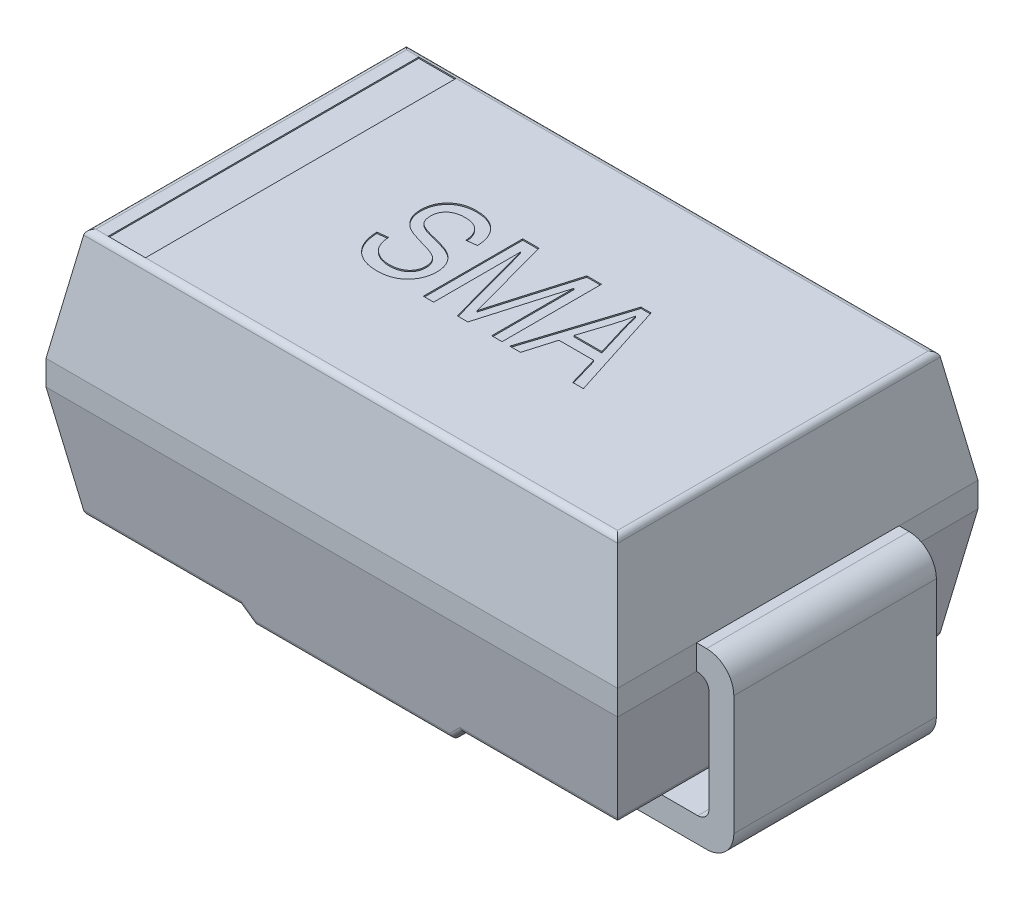
from build123d import *
from OCP.BRepFilletAPI import BRepFilletAPI_MakeChamfer

# Parameters (mm, degrees)
EXTRUDE_1_DEPTH     = 1.45
EXTRUDE_2_DEPTH     = 0.815
CHAMFER_1_SIZE      = 0.9
CHAMFER_1_SIZE_2    = 0.158694283
CHAMFER_2_SIZE      = 1
CHAMFER_2_SIZE2     = 0.176326981
FILLET_1_R          = 0.05
SKETCH_3_W          = 0.3
SKETCH_3_H          = 2.498701472
CUT_EXTRUDE_1_DEPTH = 0.01


with BuildPart() as part:
    # Эскиз1 → Бобышка-Вытянуть1 (new, symmetric)
    with BuildSketch(Plane.XY):
        Polygon((-2.3, 2.1), (-2.3, 0.1), (-0.9, 0.1), (-0.8, 0), (0.8, 0), (0.9, 0.1), (2.3, 0.1), (2.3, 2.1), align=None)
    extrude(amount=EXTRUDE_1_DEPTH, both=True)


with BuildPart() as body_2:
    # Эскиз2 → Бобышка-Вытянуть2 (new, symmetric)
    with BuildSketch(Plane.XY):
        with BuildLine():
            Line((2.3, 1.2), (2.380710678, 1.2))
            ThreePointArc((2.380710678, 1.2), (2.535771645, 1.135771645), (2.6, 0.980710678))
            Line((2.6, 0.980710678), (2.6, 0.019289322))
            ThreePointArc((2.6, 0.019289322), (2.535771645, -0.135771645), (2.380710678, -0.2))
            Line((2.380710678, -0.2), (1.1, -0.2))
            Line((1.1, -0.2), (1.1, 0))
            Line((1.1, 0), (2.31, 0))
            ThreePointArc((2.31, 0), (2.37363961, 0.02636039), (2.4, 0.09))
            Line((2.4, 0.09), (2.4, 0.91))
            ThreePointArc((2.4, 0.91), (2.37363961, 0.97363961), (2.31, 1))
            Line((2.31, 1), (2.3, 1))
            Line((2.3, 1), (2.3, 1.2))
        make_face()
    extrude_2 = extrude(amount=EXTRUDE_2_DEPTH, both=True)


with BuildPart() as part_1:
    add(part.part)

    # Зеркальное отражение2: Бобышка-Вытянуть2 across plane
    add(extrude_2.mirror(Plane(origin=(0, 0, 0), x_dir=(0, 0, 1), z_dir=(1, 0, 0))))

    # Фаска1
    # the kernel refuses this chamfer: 0.9, 0.158694283 mm, written as the material it takes off along each edge
    with BuildSketch(Plane(origin=(4.638684917, 2.1, -1.45), x_dir=(0, -0.9999776716360547, -0.006682531656101768), z_dir=(-1, 0, 0))) as chamfer_1_piece_1:
        Polygon((CHAMFER_1_SIZE * 0.999977671636, CHAMFER_1_SIZE * 0.0066825316561), (-CHAMFER_1_SIZE_2 * 0.00668253164084, CHAMFER_1_SIZE_2 * 0.999977669353), (0, 0), align=None)
    extrude(amount=9.277369834, mode=Mode.SUBTRACT)
    with BuildSketch(Plane(origin=(2.3, 2.1, 3.788684917), x_dir=(-0.9776715712462589, 0.21013876076743046, 0), z_dir=(0, 0, -1))) as chamfer_1_piece_2:
        Polygon((CHAMFER_1_SIZE_2 * 0.977671569014, -CHAMFER_1_SIZE_2 * 0.210138760288), (-CHAMFER_1_SIZE * 0.210138760767, -CHAMFER_1_SIZE * 0.977671571246), (0, 0), align=None)
    extrude(amount=7.577369834, mode=Mode.SUBTRACT)
    with BuildSketch(Plane(origin=(2.3, 0.1, 3.788684917), x_dir=(-0.9776715712462586, -0.21013876076743146, 0), z_dir=(0, 0, -1))) as chamfer_1_piece_3:
        Polygon((CHAMFER_1_SIZE_2 * 0.977671569014, CHAMFER_1_SIZE_2 * 0.210138760288), (-CHAMFER_1_SIZE * 0.210138760767, CHAMFER_1_SIZE * 0.977671571246), (0, 0), align=None)
    extrude(amount=7.577369834, mode=Mode.SUBTRACT)
    with BuildSketch(Plane(origin=(-2.3, 0.1, -3.788684917), x_dir=(-0.006682531656101531, 0.9999776716360547, 0), z_dir=(0, 0, 1))) as chamfer_1_piece_4_section:
        Polygon((CHAMFER_1_SIZE * 0.999977671636, -CHAMFER_1_SIZE * 0.0066825316561), (-CHAMFER_1_SIZE_2 * 0.00668253164084, -CHAMFER_1_SIZE_2 * 0.999977669353), (0, 0), align=None)
    chamfer_1_piece_4 = extrude(amount=7.577369834, mode=Mode.PRIVATE)
    chamfer_1_piece_4 = split(chamfer_1_piece_4, bisect_by=Plane(origin=(-2.256706668, 0.418093055, -0.815), z_dir=(0, 0, -1)), keep=Keep.TOP, mode=Mode.PRIVATE)
    chamfer_1_piece_4 = split(chamfer_1_piece_4, bisect_by=Plane(origin=(-2.256706668, 1, -2.301842458), z_dir=(0, -1, 0)), keep=Keep.TOP, mode=Mode.PRIVATE)
    add(chamfer_1_piece_4, mode=Mode.SUBTRACT)
    with BuildSketch(Plane(origin=(-2.3, 0.1, -3.788684917), x_dir=(-0.006682531656101531, 0.9999776716360547, 0), z_dir=(0, 0, 1))) as chamfer_1_piece_5_section:
        Polygon((CHAMFER_1_SIZE * 0.999977671636, -CHAMFER_1_SIZE * 0.0066825316561), (-CHAMFER_1_SIZE_2 * 0.00668253164084, -CHAMFER_1_SIZE_2 * 0.999977669353), (0, 0), align=None)
    chamfer_1_piece_5 = extrude(amount=7.577369834, mode=Mode.PRIVATE)
    chamfer_1_piece_5 = split(chamfer_1_piece_5, bisect_by=Plane(origin=(-2.256706668, 0.418093055, 0.815), z_dir=(0, 0, -1)), keep=Keep.TOP, mode=Mode.PRIVATE)
    chamfer_1_piece_5 = split(chamfer_1_piece_5, bisect_by=Plane(origin=(-2.256706668, 0.418093055, -0.815), z_dir=(0, 0, 1)), keep=Keep.TOP, mode=Mode.PRIVATE)
    chamfer_1_piece_5 = split(chamfer_1_piece_5, bisect_by=Plane(origin=(-2.256706668, 1, 0), z_dir=(0, -1, 0)), keep=Keep.TOP, mode=Mode.PRIVATE)
    add(chamfer_1_piece_5, mode=Mode.SUBTRACT)
    with BuildSketch(Plane(origin=(-2.3, 0.1, -3.788684917), x_dir=(-0.006682531656101531, 0.9999776716360547, 0), z_dir=(0, 0, 1))) as chamfer_1_piece_6_section:
        Polygon((CHAMFER_1_SIZE * 0.999977671636, -CHAMFER_1_SIZE * 0.0066825316561), (-CHAMFER_1_SIZE_2 * 0.00668253164084, -CHAMFER_1_SIZE_2 * 0.999977669353), (0, 0), align=None)
    chamfer_1_piece_6 = extrude(amount=7.577369834, mode=Mode.PRIVATE)
    chamfer_1_piece_6 = split(chamfer_1_piece_6, bisect_by=Plane(origin=(-2.256706668, 0.418093055, 0.815), z_dir=(0, 0, 1)), keep=Keep.TOP, mode=Mode.PRIVATE)
    chamfer_1_piece_6 = split(chamfer_1_piece_6, bisect_by=Plane(origin=(-2.256706668, 1, 2.301842458), z_dir=(0, -1, 0)), keep=Keep.TOP, mode=Mode.PRIVATE)
    add(chamfer_1_piece_6, mode=Mode.SUBTRACT)
    with BuildSketch(Plane(origin=(-2.3, 2.1, 3.788684917), x_dir=(-0.006682531656101531, -0.9999776716360547, 0), z_dir=(0, 0, -1))) as chamfer_1_piece_7_section:
        Polygon((CHAMFER_1_SIZE * 0.999977671636, -CHAMFER_1_SIZE * 0.0066825316561), (-CHAMFER_1_SIZE_2 * 0.00668253164084, -CHAMFER_1_SIZE_2 * 0.999977669353), (0, 0), align=None)
    chamfer_1_piece_7 = extrude(amount=7.577369834, mode=Mode.PRIVATE)
    chamfer_1_piece_7 = split(chamfer_1_piece_7, bisect_by=Plane(origin=(-2.256706668, 1.781906945, 0.815), z_dir=(0, 0, 1)), keep=Keep.TOP, mode=Mode.PRIVATE)
    chamfer_1_piece_7 = split(chamfer_1_piece_7, bisect_by=Plane(origin=(-2.256706668, 1.2, 2.301842458), z_dir=(0, 1, 0)), keep=Keep.TOP, mode=Mode.PRIVATE)
    add(chamfer_1_piece_7, mode=Mode.SUBTRACT)
    with BuildSketch(Plane(origin=(-2.3, 2.1, 3.788684917), x_dir=(-0.006682531656101531, -0.9999776716360547, 0), z_dir=(0, 0, -1))) as chamfer_1_piece_8_section:
        Polygon((CHAMFER_1_SIZE * 0.999977671636, -CHAMFER_1_SIZE * 0.0066825316561), (-CHAMFER_1_SIZE_2 * 0.00668253164084, -CHAMFER_1_SIZE_2 * 0.999977669353), (0, 0), align=None)
    chamfer_1_piece_8 = extrude(amount=7.577369834, mode=Mode.PRIVATE)
    chamfer_1_piece_8 = split(chamfer_1_piece_8, bisect_by=Plane(origin=(-2.256706668, 1.781906945, 0.815), z_dir=(0, 0, -1)), keep=Keep.TOP, mode=Mode.PRIVATE)
    chamfer_1_piece_8 = split(chamfer_1_piece_8, bisect_by=Plane(origin=(-2.256706668, 1.2, 0), z_dir=(0, 1, 0)), keep=Keep.TOP, mode=Mode.PRIVATE)
    chamfer_1_piece_8 = split(chamfer_1_piece_8, bisect_by=Plane(origin=(-2.256706668, 1.781906945, -0.815), z_dir=(0, 0, 1)), keep=Keep.TOP, mode=Mode.PRIVATE)
    add(chamfer_1_piece_8, mode=Mode.SUBTRACT)
    with BuildSketch(Plane(origin=(-2.3, 2.1, 3.788684917), x_dir=(-0.006682531656101531, -0.9999776716360547, 0), z_dir=(0, 0, -1))) as chamfer_1_piece_9_section:
        Polygon((CHAMFER_1_SIZE * 0.999977671636, -CHAMFER_1_SIZE * 0.0066825316561), (-CHAMFER_1_SIZE_2 * 0.00668253164084, -CHAMFER_1_SIZE_2 * 0.999977669353), (0, 0), align=None)
    chamfer_1_piece_9 = extrude(amount=7.577369834, mode=Mode.PRIVATE)
    chamfer_1_piece_9 = split(chamfer_1_piece_9, bisect_by=Plane(origin=(-2.256706668, 1.2, -2.301842458), z_dir=(0, 1, 0)), keep=Keep.TOP, mode=Mode.PRIVATE)
    chamfer_1_piece_9 = split(chamfer_1_piece_9, bisect_by=Plane(origin=(-2.256706668, 1.781906945, -0.815), z_dir=(0, 0, -1)), keep=Keep.TOP, mode=Mode.PRIVATE)
    add(chamfer_1_piece_9, mode=Mode.SUBTRACT)
    with BuildSketch(Plane(origin=(4.638684917, 2.1, 1.45), x_dir=(0, 0.21013876076743018, -0.9776715712462589), z_dir=(-1, 0, 0))) as chamfer_1_piece_10:
        Polygon((CHAMFER_1_SIZE_2 * 0.977671569014, CHAMFER_1_SIZE_2 * 0.210138760288), (-CHAMFER_1_SIZE * 0.210138760767, CHAMFER_1_SIZE * 0.977671571246), (0, 0), align=None)
    extrude(amount=9.277369834, mode=Mode.SUBTRACT)

    # Фаска2: one chamfer whose edges measure the first distance from different faces: ONE call of the kernel's chamfer builder (chamfer() names one face for all edges)
    chamfer_2_edges_1 = [part_1.edges().sort_by_distance(p)[0] for p in [
        (0, 0, -1.45),
    ]]
    chamfer_2_side_1 = [part_1.faces().sort_by_distance(p)[0] for p in [
        (0, 0.63700121, -1.45),
    ]]
    chamfer_2_edges_2 = [part_1.edges().sort_by_distance(p)[0] for p in [
        (0, 0, 1.45),
    ]]
    chamfer_2_side_2 = [part_1.faces().sort_by_distance(p)[0] for p in [
        (0, 0.63700121, 1.45),
    ]]
    chamfer_2 = BRepFilletAPI_MakeChamfer(part_1.part.solid().wrapped)
    for e in chamfer_2_edges_1:
        chamfer_2.Add(CHAMFER_2_SIZE, CHAMFER_2_SIZE2, e.wrapped, chamfer_2_side_1[0].wrapped)  # the first distance lies on this face
    for e in chamfer_2_edges_2:
        chamfer_2.Add(CHAMFER_2_SIZE, CHAMFER_2_SIZE2, e.wrapped, chamfer_2_side_2[0].wrapped)  # the first distance lies on this face
    add(Compound.cast(chamfer_2.Shape()), mode=Mode.REPLACE)

    # Скругление1
    fillet_1_edges = [part_1.edges().sort_by_distance(p)[0] for p in [
        (2.141305717, 2.1, 0),
        (0, 2.1, 1.291305717),
        (-2.141305717, 2.1, 0),
        (0, 2.1, -1.291305717),
        (0, 0, 1.273673019),
        (0, 0, -1.273673019),
        (0.85, 0.05, 1.282489368),
        (0.85, 0.05, -1.282489368),
        (2.141305717, 0.1, 0),
        (1.520652859, 0.1, 1.291305717),
        (1.520652859, 0.1, -1.291305717),
        (-2.141305717, 0.1, 0),
        (-1.520652859, 0.1, 1.291305717),
        (-1.520652859, 0.1, -1.291305717),
        (-0.85, 0.05, 1.282489368),
        (-0.85, 0.05, -1.282489368),
    ]]
    fillet(fillet_1_edges, radius=FILLET_1_R)

    # Эскиз3 → Вырез-Вытянуть1 (cut)
    # profile 1 of 4: a face of its own
    with BuildSketch(Plane(origin=(0, 2.1, 0), x_dir=(1, 0, 0), z_dir=(0, 1, 0))):
        with Locations((-1.85, 0)):
            Rectangle(SKETCH_3_W, SKETCH_3_H)
    # profile 2 of 4: a face of its own
    with BuildSketch(Plane(origin=(0, 2.1, 0), x_dir=(1, 0, 0), z_dir=(0, 1, 0))):
        with BuildLine():
            Line((-0.948051948, -0.139610476), (-0.864935065, -0.129220866))
            add(Edge.make_bspline(
                [(-0.864935065, -0.129220866), (-0.863724835, -0.139802317), (-0.861429624, -0.159870121), (-0.855143425, -0.18797335), (-0.846735616, -0.21238928), (-0.836348316, -0.233609789), (-0.823037108, -0.251597597), (-0.807832278, -0.267774625), (-0.789923169, -0.281887699), (-0.769875629, -0.294208498), (-0.747810078, -0.304152386), (-0.7241363, -0.311023331), (-0.699188477, -0.315420952), (-0.682107704, -0.315958882), (-0.673376623, -0.316233853)],
                knots=[0, 0, 0, 0, 1.28056062, 2.428593037, 3.455857635, 4.381585452, 5.257863862, 6.137303782, 7.045121912, 7.991827123, 8.962072888, 9.946560163, 10.950355038, 12, 12, 12, 12], degree=3))
            add(Edge.make_bspline(
                [(-0.673376623, -0.316233853), (-0.667148535, -0.316107287), (-0.655044754, -0.315861317), (-0.637420248, -0.31401127), (-0.620819779, -0.311224391), (-0.605399455, -0.306888821), (-0.590872608, -0.301818823), (-0.577648189, -0.295059531), (-0.56527297, -0.287420554), (-0.554106362, -0.278526756), (-0.544259864, -0.268530418), (-0.535334695, -0.258039284), (-0.528077855, -0.246554074), (-0.521958674, -0.234527639), (-0.517471246, -0.221663909), (-0.513990672, -0.208219035), (-0.512050262, -0.19394178), (-0.511810853, -0.184204748), (-0.511688312, -0.179220866)],
                knots=[0, 0, 0, 0, 1.25000475, 2.42928239, 3.554432982, 4.624373226, 5.641561959, 6.637472043, 7.59895824, 8.557494333, 9.494616268, 10.412591127, 11.316575992, 12.215324116, 13.115580924, 14.045624415, 14.999656403, 16, 16, 16, 16], degree=3))
            add(Edge.make_bspline(
                [(-0.511688312, -0.179220866), (-0.511866993, -0.173472711), (-0.512215021, -0.162276701), (-0.515177313, -0.145978279), (-0.520228167, -0.130874404), (-0.527104191, -0.116849453), (-0.53598473, -0.104016056), (-0.546951914, -0.09243701), (-0.559983802, -0.082201721), (-0.572418727, -0.074439442), (-0.584431068, -0.068785711), (-0.595780081, -0.063912266), (-0.609447902, -0.058771589), (-0.625412385, -0.053238594), (-0.643678587, -0.047474405), (-0.664256572, -0.041298267), (-0.687074413, -0.03462921), (-0.703131678, -0.030224714), (-0.711525974, -0.027922164)],
                knots=[0, 0, 0, 0, 1.005239862, 1.957963033, 2.886140254, 3.783827184, 4.682063204, 5.60636897, 6.563082868, 7.574767638, 8.163399764, 8.884479363, 9.735568196, 10.717712603, 11.840607427, 13.08667948, 14.476996158, 16, 16, 16, 16], degree=3))
            add(Edge.make_bspline(
                [(-0.711525974, -0.027922164), (-0.719059289, -0.025796638), (-0.733577148, -0.021700422), (-0.754396147, -0.015144882), (-0.773573393, -0.008781533), (-0.790990678, -0.001992543), (-0.806866746, 0.004455018), (-0.82088905, 0.011374218), (-0.833272332, 0.018149251), (-0.847513674, 0.02713717), (-0.863068676, 0.039707622), (-0.879554822, 0.056504696), (-0.893956535, 0.07510408), (-0.905972183, 0.09550415), (-0.915717434, 0.117454418), (-0.922170441, 0.141115219), (-0.926671167, 0.166008744), (-0.927069686, 0.183149821), (-0.927272727, 0.19188303)],
                knots=[0, 0, 0, 0, 1.113815205, 2.146493548, 3.105946624, 3.988323839, 4.806360381, 5.543364066, 6.212027532, 6.814445107, 7.937696897, 9.048553401, 10.157540001, 11.276136463, 12.410655589, 13.563606105, 14.758681343, 16, 16, 16, 16], degree=3))
            add(Edge.make_bspline(
                [(-0.927272727, 0.19188303), (-0.927093563, 0.199739168), (-0.926741361, 0.215182751), (-0.923734688, 0.237786425), (-0.918968896, 0.259368366), (-0.911857389, 0.279698064), (-0.903156784, 0.299065056), (-0.892138327, 0.317080615), (-0.879397306, 0.33417647), (-0.864646139, 0.349946278), (-0.848398921, 0.364408844), (-0.830469789, 0.376839491), (-0.811237219, 0.387373234), (-0.79069719, 0.396273297), (-0.768660865, 0.40285438), (-0.745337715, 0.40748677), (-0.720696597, 0.410530864), (-0.70379725, 0.410866654), (-0.69512987, 0.411038875)],
                knots=[0, 0, 0, 0, 1.048547399, 2.061232895, 3.039277619, 3.994368589, 4.931972946, 5.868741773, 6.808014961, 7.774272834, 8.746911737, 9.706990873, 10.680354074, 11.670809819, 12.690200298, 13.744432806, 14.843158913, 16, 16, 16, 16], degree=3))
            add(Edge.make_bspline(
                [(-0.69512987, 0.411038875), (-0.683313351, 0.410708985), (-0.660256217, 0.410065284), (-0.626810306, 0.404681757), (-0.595663448, 0.395561396), (-0.566934049, 0.382870252), (-0.540846416, 0.366848558), (-0.517847998, 0.347399149), (-0.497783996, 0.324957008), (-0.481092665, 0.299280668), (-0.467583322, 0.27095718), (-0.45769102, 0.240111881), (-0.451241843, 0.206910388), (-0.449992744, 0.183904115), (-0.449350649, 0.172077836)],
                knots=[0, 0, 0, 0, 1.10297814, 2.152200164, 3.153123011, 4.125894755, 5.076644034, 6.001845166, 6.928824672, 7.877651763, 8.851800581, 9.850539915, 10.895078977, 12, 12, 12, 12], degree=3))
            Line((-0.449350649, 0.172077836), (-0.532467532, 0.161688225))
            add(Edge.make_bspline(
                [(-0.532467532, 0.161688225), (-0.53307726, 0.16808564), (-0.534266275, 0.180561092), (-0.53755154, 0.198507662), (-0.541750523, 0.215240515), (-0.547014974, 0.230668161), (-0.55363008, 0.244733464), (-0.560995179, 0.257596411), (-0.569573903, 0.269124087), (-0.579145143, 0.279379774), (-0.58981396, 0.288360809), (-0.601437547, 0.296232417), (-0.614114729, 0.302899888), (-0.627868048, 0.308214087), (-0.642518505, 0.312490051), (-0.658244394, 0.315333865), (-0.674957424, 0.317150694), (-0.686466894, 0.317402982), (-0.69237013, 0.317532381)],
                knots=[0, 0, 0, 0, 1.225165016, 2.389166377, 3.475498799, 4.513395989, 5.492249234, 6.435697439, 7.335638185, 8.226419293, 9.105162265, 9.989643781, 10.899061877, 11.830466535, 12.797276613, 13.805291738, 14.874328703, 16, 16, 16, 16], degree=3))
            add(Edge.make_bspline(
                [(-0.69237013, 0.317532381), (-0.698382999, 0.31748088), (-0.710005057, 0.317381335), (-0.726908518, 0.315417726), (-0.742736952, 0.312824439), (-0.75751184, 0.308875364), (-0.77110586, 0.303891535), (-0.783708137, 0.297806317), (-0.795147517, 0.290563797), (-0.805485946, 0.28221296), (-0.814539921, 0.272927218), (-0.822504907, 0.263051743), (-0.829316439, 0.252548357), (-0.834625351, 0.241258588), (-0.83886516, 0.22935031), (-0.841981156, 0.216799525), (-0.843755811, 0.203567951), (-0.844020727, 0.19453974), (-0.844155844, 0.189934978)],
                knots=[0, 0, 0, 0, 1.28677749, 2.487165856, 3.639785246, 4.719183444, 5.756778416, 6.736320351, 7.710431992, 8.649732596, 9.575714218, 10.482424581, 11.363216052, 12.249555033, 13.147559346, 14.066626488, 15.013899474, 16, 16, 16, 16], degree=3))
            add(Edge.make_bspline(
                [(-0.844155844, 0.189934978), (-0.843880437, 0.181680908), (-0.843356764, 0.165986175), (-0.838460956, 0.143876783), (-0.83031188, 0.124497702), (-0.822046902, 0.113920357), (-0.818019481, 0.108766147)],
                knots=[0, 0, 0, 0, 1.135097977, 2.158336086, 3.102579849, 4, 4, 4, 4], degree=3))
            add(Edge.make_bspline(
                [(-0.818019481, 0.108766147), (-0.815546628, 0.106300263), (-0.810175722, 0.100944489), (-0.799831539, 0.094196779), (-0.78751841, 0.087097966), (-0.772596552, 0.080659588), (-0.755609794, 0.073908768), (-0.736129247, 0.067719555), (-0.714401984, 0.061315767), (-0.698988932, 0.057512923), (-0.690909091, 0.055519394)],
                knots=[0, 0, 0, 0, 0.600125557, 1.303441474, 2.117395318, 3.047759802, 4.098473224, 5.265768101, 6.566659033, 8, 8, 8, 8], degree=3))
            add(Edge.make_bspline(
                [(-0.690909091, 0.055519394), (-0.682947682, 0.053598712), (-0.667649848, 0.049908125), (-0.645711544, 0.044152168), (-0.625557297, 0.038831762), (-0.607217041, 0.033736309), (-0.590818126, 0.028464146), (-0.57621572, 0.02357625), (-0.563326785, 0.019211361), (-0.555555498, 0.015847253), (-0.551948052, 0.014285628)],
                knots=[0, 0, 0, 0, 1.354590389, 2.602843464, 3.751324185, 4.802492375, 5.750771121, 6.599881396, 7.350062303, 8, 8, 8, 8], degree=3))
            add(Edge.make_bspline(
                [(-0.551948052, 0.014285628), (-0.542216141, 0.00957847), (-0.523347701, 0.000452129), (-0.498195177, -0.017437001), (-0.47665279, -0.037764006), (-0.459123336, -0.060979647), (-0.445288222, -0.086572495), (-0.435597193, -0.114643763), (-0.429599829, -0.144984288), (-0.428920587, -0.165988677), (-0.428571429, -0.176785801)],
                knots=[0, 0, 0, 0, 1.070280572, 2.075083192, 3.046573603, 3.996247495, 4.946860593, 5.919165523, 6.930365132, 8, 8, 8, 8], degree=3))
            add(Edge.make_bspline(
                [(-0.428571429, -0.176785801), (-0.428924503, -0.187636585), (-0.429622146, -0.209076737), (-0.43581412, -0.240437605), (-0.44593117, -0.27032355), (-0.460082179, -0.298249429), (-0.477399941, -0.323960108), (-0.497779185, -0.346767379), (-0.521310841, -0.366113432), (-0.547664587, -0.382088048), (-0.576842299, -0.394763102), (-0.608969436, -0.403304148), (-0.643802695, -0.408833727), (-0.667996799, -0.409431133), (-0.680519481, -0.409740346)],
                knots=[0, 0, 0, 0, 1.011281659, 1.998199493, 2.968653118, 3.946038549, 4.909179922, 5.852720419, 6.788493457, 7.73981833, 8.718701351, 9.744837575, 10.832745308, 12, 12, 12, 12], degree=3))
            add(Edge.make_bspline(
                [(-0.680519481, -0.409740346), (-0.690378266, -0.409533618), (-0.709616399, -0.409130214), (-0.737653222, -0.405656594), (-0.764129294, -0.40000482), (-0.789103587, -0.392039961), (-0.812613715, -0.381773168), (-0.834633924, -0.36925103), (-0.85505492, -0.354386516), (-0.873715907, -0.337283781), (-0.89059176, -0.318308047), (-0.90546206, -0.297617761), (-0.918040599, -0.275163168), (-0.928341406, -0.251127372), (-0.936719425, -0.225553456), (-0.942845814, -0.198383761), (-0.946761964, -0.169533335), (-0.947615189, -0.14974167), (-0.948051948, -0.139610476)],
                knots=[0, 0, 0, 0, 1.104995383, 2.156254069, 3.161771291, 4.136451373, 5.090038804, 6.032932257, 6.970972664, 7.915738022, 8.865457713, 9.813334699, 10.766787024, 11.745048075, 12.740780621, 13.779854267, 14.863525297, 16, 16, 16, 16], degree=3))
        make_face()
    # profile 3 of 4: a face of its own
    with BuildSketch(Plane(origin=(0, 2.1, 0), x_dir=(1, 0, 0), z_dir=(0, 1, 0))):
        with BuildLine():
            Line((-0.314285714, -0.399350736), (-0.314285714, 0.400649264))
            Line((-0.314285714, 0.400649264), (-0.184253247, 0.400649264))
            Line((-0.184253247, 0.400649264), (-0.028571429, -0.16574684))
            Line((-0.028571429, -0.16574684), (0.002597403, -0.284253333))
            add(Edge.make_bspline(
                [(0.002597403, -0.284253333), (0.003614132, -0.280354154), (0.00575056, -0.272160912), (0.009375547, -0.259241952), (0.013465758, -0.245103755), (0.017590679, -0.229624769), (0.022353243, -0.213026857), (0.027573871, -0.195192968), (0.033084428, -0.176034416), (0.036853158, -0.162825474), (0.038798701, -0.15600658)],
                knots=[0, 0, 0, 0, 0.72569615, 1.52488642, 2.416426408, 3.376296137, 4.409732583, 5.526177123, 6.722930645, 8, 8, 8, 8], degree=3))
            Line((0.038798701, -0.15600658), (0.201785714, 0.400649264))
            Line((0.201785714, 0.400649264), (0.319480519, 0.400649264))
            Line((0.319480519, 0.400649264), (0.319480519, -0.399350736))
            Line((0.319480519, -0.399350736), (0.236363636, -0.399350736))
            Line((0.236363636, -0.399350736), (0.236363636, 0.261038875))
            Line((0.236363636, 0.261038875), (0.044318182, -0.399350736))
            Line((0.044318182, -0.399350736), (-0.040746753, -0.399350736))
            Line((-0.040746753, -0.399350736), (-0.231168831, 0.29886355))
            Line((-0.231168831, 0.29886355), (-0.231168831, -0.399350736))
            Line((-0.231168831, -0.399350736), (-0.314285714, -0.399350736))
        make_face()
    # profile 4 of 4: a face of its own
    with BuildSketch(Plane(origin=(0, 2.1, 0), x_dir=(1, 0, 0), z_dir=(0, 1, 0))):
        Polygon((0.381818182, -0.399350736), (0.637337662, 0.400649264), (0.718344156, 0.400649264), (0.974025974, -0.399350736), (0.887662338, -0.399350736), (0.817694805, -0.160389697), (0.538149351, -0.160389697), (0.468344156, -0.399350736), align=None)
        with BuildLine():
            Line((0.565422078, -0.066883203), (0.79025974, -0.066883203))
            Line((0.79025974, -0.066883203), (0.723376623, 0.152921991))
            add(Edge.make_bspline(
                [(0.723376623, 0.152921991), (0.720874509, 0.16114326), (0.715989496, 0.17719409), (0.709071872, 0.200697443), (0.702432525, 0.222989935), (0.696761243, 0.244227067), (0.69112183, 0.264132523), (0.686258219, 0.282927818), (0.681892319, 0.300519673), (0.679210404, 0.31190217), (0.677922078, 0.317370043)],
                knots=[0, 0, 0, 0, 1.20859176, 2.359599242, 3.445754582, 4.479676267, 5.450859039, 6.355343929, 7.209947359, 8, 8, 8, 8], degree=3))
            add(Edge.make_bspline(
                [(0.677922078, 0.317370043), (0.67558321, 0.304633877), (0.67090858, 0.279178463), (0.66214617, 0.241257905), (0.652397724, 0.203405776), (0.64463832, 0.178433386), (0.640746753, 0.165909004)],
                knots=[0, 0, 0, 0, 0.995500629, 1.989678841, 2.991765375, 4, 4, 4, 4], degree=3))
            Line((0.640746753, 0.165909004), (0.565422078, -0.066883203))
        make_face(mode=Mode.SUBTRACT)
    extrude(amount=-CUT_EXTRUDE_1_DEPTH, mode=Mode.SUBTRACT)


solid = Compound([body_2.part, part_1.part])
